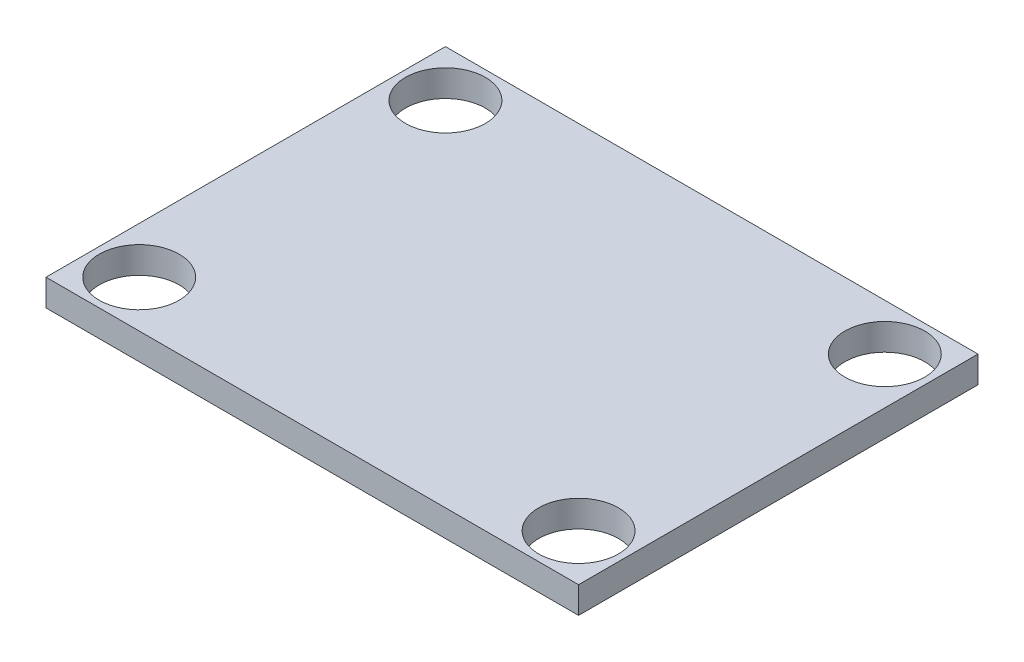
from build123d import *

# Parameters (mm, degrees)
SKETCH1_W           = 40
SKETCH1_H           = 30
SKETCH1_R           = 3
BOSS_EXTRUDE1_DEPTH = 2


with BuildPart() as part:
    # Sketch1 → Boss-Extrude1 (new body)
    with BuildSketch(Plane(origin=(0, 0, 0), x_dir=(1, 0, 0), z_dir=(0, 1, 0))):
        with Locations((20, 15)):
            Rectangle(SKETCH1_W, SKETCH1_H)
        with Locations((3.5, 3.5)):
            Circle(SKETCH1_R, mode=Mode.SUBTRACT)
        with Locations((36.5, 3.5)):
            Circle(SKETCH1_R, mode=Mode.SUBTRACT)
        with Locations((36.5, 26.5)):
            Circle(SKETCH1_R, mode=Mode.SUBTRACT)
        with Locations((3.5, 26.5)):
            Circle(SKETCH1_R, mode=Mode.SUBTRACT)
    extrude(amount=BOSS_EXTRUDE1_DEPTH)


solid = part.part
